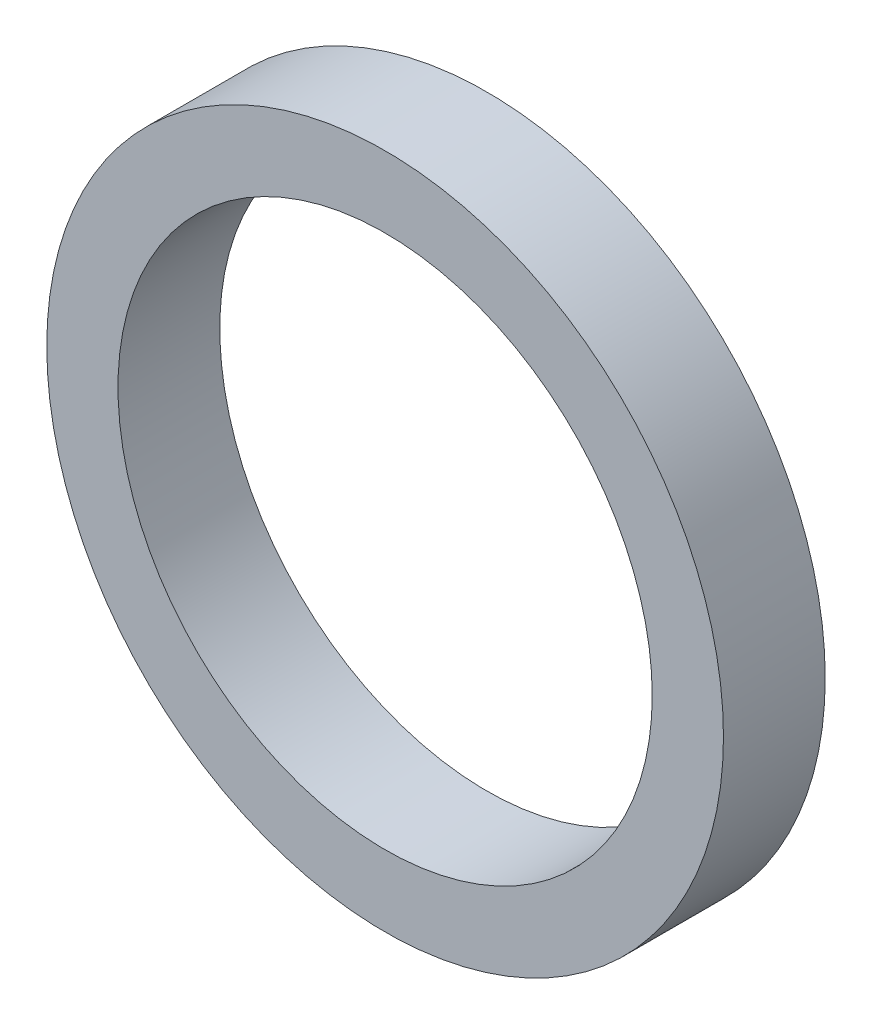
from build123d import *

# Parameters (mm, degrees)
SKETCH1_R           = 3.325
SKETCH1_R_2         = 2.625
BOSS_EXTRUDE1_DEPTH = 1


with BuildPart() as part:
    # Sketch1 → Boss-Extrude1 (new body)
    with BuildSketch(Plane.XY.offset(3)):
        with Locations((32.5, 0)):
            Circle(SKETCH1_R)
        with Locations((32.5, 0)):
            Circle(SKETCH1_R_2, mode=Mode.SUBTRACT)
    extrude(amount=BOSS_EXTRUDE1_DEPTH)


solid = part.part
